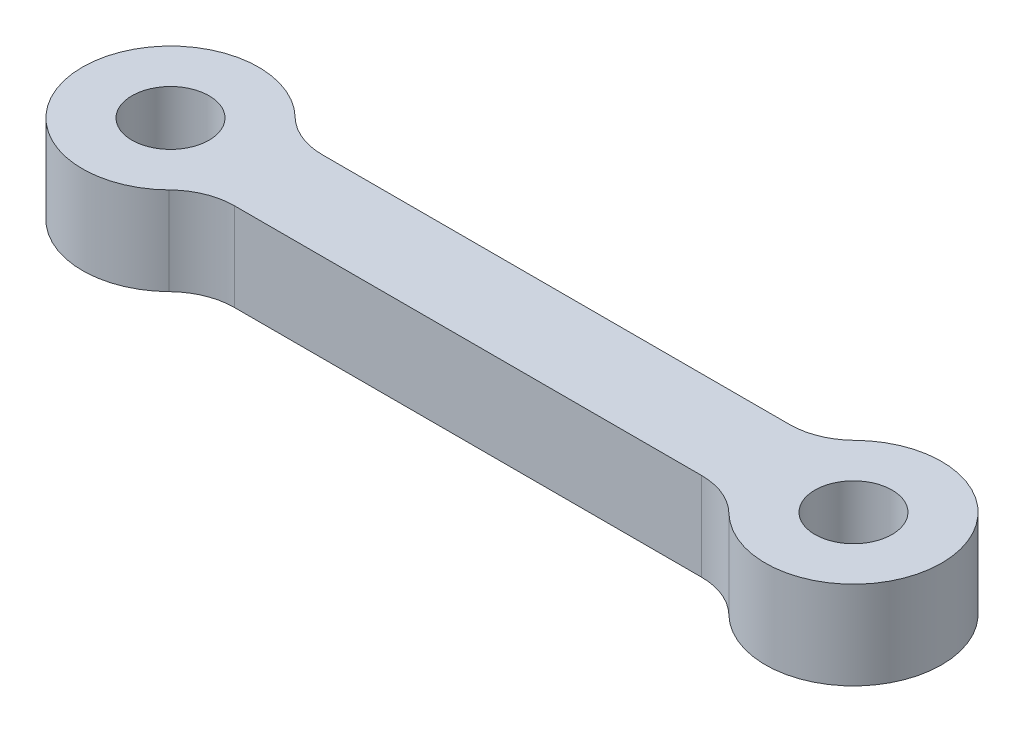
from build123d import *

# Parameters (mm, degrees)
SKETCH1_R           = 1.75
BOSS_EXTRUDE1_DEPTH = 4
FILLET1_R           = 3


with BuildPart() as part:
    # Sketch1 → Boss-Extrude1 (new body)
    with BuildSketch(Plane(origin=(0, 0, 0), x_dir=(1, 0, 0), z_dir=(0, 1, 0))):
        with BuildLine():
            ThreePointArc((3.464101615, 2), (-4, 0), (3.464101615, -2))
            Line((3.464101615, -2), (27.535898385, -2))
            ThreePointArc((27.535898385, -2), (35, 0), (27.535898385, 2))
            Line((27.535898385, 2), (3.464101615, 2))
        make_face()
        Circle(SKETCH1_R, mode=Mode.SUBTRACT)
        with Locations((31, 0)):
            Circle(SKETCH1_R, mode=Mode.SUBTRACT)
    extrude(amount=BOSS_EXTRUDE1_DEPTH)

    # Fillet1
    fillet1_edges = [part.edges().sort_by_distance(p)[0] for p in [
        (27.535898385, 2, 2),
        (3.464101615, 2, -2),
        (27.535898385, 2, -2),
        (3.464101615, 2, 2),
    ]]
    fillet(fillet1_edges, radius=FILLET1_R)


solid = part.part
